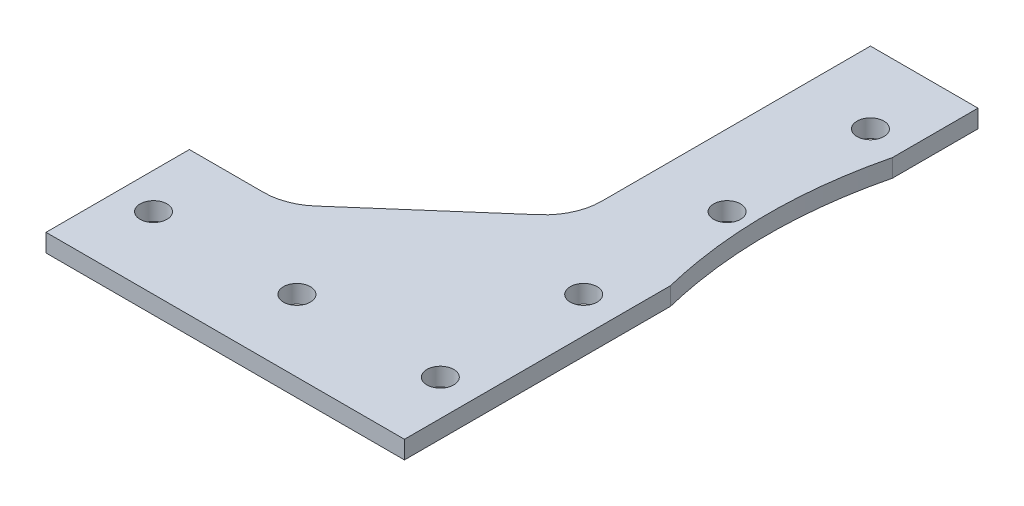
from build123d import *

# Parameters (mm, degrees)
SKETCH1_W           = 63.5
SKETCH1_H           = 101.6
BOSS_EXTRUDE1_DEPTH = 3.175
SKETCH2_R           = 2.38125
CUT_EXTRUDE1_DEPTH  = 3.175
CUT_EXTRUDE2_DEPTH  = 60.989858518
FILLET1_R           = 10.16
CUT_EXTRUDE3_DEPTH  = 60.989858518


with BuildPart() as part:
    # Sketch1 → Boss-Extrude1 (new body)
    with BuildSketch(Plane(origin=(0, 0, 0), x_dir=(1, 0, 0), z_dir=(0, 1, 0))):
        Rectangle(SKETCH1_W, SKETCH1_H)
    extrude(amount=BOSS_EXTRUDE1_DEPTH)

    # Sketch2 → Cut-Extrude1 (cut)
    with BuildSketch(Plane(origin=(0, 3.175, 0), x_dir=(1, 0, 0), z_dir=(0, 1, 0))):
        with Locations((25.4, -38.1)):
            Circle(SKETCH2_R)
        with Locations((25.4, -12.7)):
            Circle(SKETCH2_R)
        with Locations((25.4, 12.7)):
            Circle(SKETCH2_R)
        with Locations((25.4, 38.1)):
            Circle(SKETCH2_R)
        with Locations((0, -38.1)):
            Circle(SKETCH2_R)
        with Locations((-25.4, -38.1)):
            Circle(SKETCH2_R)
        with Locations((-50.8, -38.1)):
            Circle(SKETCH2_R)
    extrude(amount=-CUT_EXTRUDE1_DEPTH, mode=Mode.SUBTRACT)

    # Sketch3 → Cut-Extrude2 (cut, through all)
    with BuildSketch(Plane(origin=(0, 3.175, 0), x_dir=(1, 0, 0), z_dir=(0, 1, 0))):
        Polygon((12.7, -1.394859213), (12.7, 50.8), (-31.75, 50.8), (-31.75, -25.4), (-14.78158839, -25.4), align=None)
    extrude(amount=-CUT_EXTRUDE2_DEPTH, mode=Mode.SUBTRACT)

    # Fillet1
    fillet1_edges = [part.edges().sort_by_distance(p)[0] for p in [
        (12.7, 1.5875, 1.394859213),
        (-14.78158839, 1.5875, 25.4),
    ]]
    fillet(fillet1_edges, radius=FILLET1_R)

    # Sketch4 → Cut-Extrude3 (cut, through all)
    with BuildSketch(Plane(origin=(0, 3.175, 0), x_dir=(1, 0, 0), z_dir=(0, 1, 0))):
        with BuildLine():
            Line((31.75, 35.65276106), (31.75, -3.673059162))
            add(Edge.make_bspline(
                [(31.75, 35.65276106), (26.951338673, 15.988382845), (31.75, -3.673059162)],
                knots=[0, 0, 0, 1, 1, 1], degree=2))
        make_face()
    extrude(amount=-CUT_EXTRUDE3_DEPTH, mode=Mode.SUBTRACT)


solid = part.part
